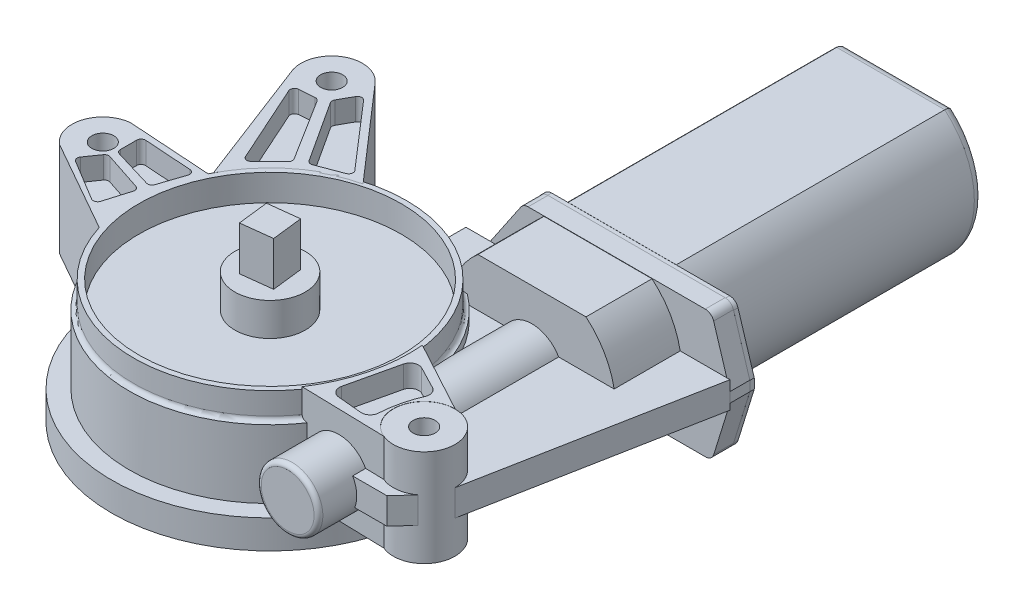
from build123d import *

# Parameters (mm, degrees)
EXTRUDE_1_DEPTH      = 63
SKETCH_4_R           = 6.75
EXTRUDE_2_DEPTH      = 5
SKETCH_5_R           = 2.5
EXTRUDE_3_DEPTH      = 2
EXTRUDE_3_TAPER      = 33
EXTRUDE_4_DEPTH      = 1
SKETCH_8_R           = 36
EXTRUDE_5_DEPTH      = 6.5
SKETCH_10_R          = 32
EXTRUDE_6_DEPTH      = 15.5
SKETCH_11_R          = 31
SKETCH_11_R_2        = 29.8
EXTRUDE_7_DEPTH      = 6
FILLET_1_R           = 1
CUT_EXTRUDE_8_DEPTH  = 1.2
SKETCH_13_R          = 8
EXTRUDE_9_DEPTH      = 7.5
EXTRUDE_10_DEPTH     = 10
SKETCH_15_R          = 7
EXTRUDE_11_DEPTH     = 75
EXTRUDE_12_DEPTH     = 19.5
EXTRUDE_13_DEPTH     = 4.5
FILLET_2_R           = 1
SKETCH_19_R          = 7
SKETCH_19_R_2        = 2.5
EXTRUDE_16_DEPTH     = 22
EXTRUDE_15_DEPTH     = 6
EXTRUDE_21_DEPTH     = 22
CUT_EXTRUDE_23_DEPTH = 5
CUT_EXTRUDE_24_DEPTH = 5
SKETCH_23_R          = 2.5
EXTRUDE_27_DEPTH     = 21.5
CUT_EXTRUDE_28_DEPTH = 5
CUT_EXTRUDE_29_DEPTH = 5
SKETCH_26_R          = 2.5
EXTRUDE_30_DEPTH     = 21.5
CUT_EXTRUDE_31_DEPTH = 5
CUT_EXTRUDE_START    = 5
CUT_EXTRUDE_32_DEPTH = 5
FILLET_3_R           = 2
FILLET_4_R           = 1
FILLET_5_R           = 0.5


with BuildPart() as part:
    # Эскиз3 → Вытянуть1 (new body)
    with BuildSketch(Plane.XY):
        with BuildLine():
            Line((-12.278029158, 14.5), (12.278029158, 14.5))
            ThreePointArc((12.278029158, 14.5), (19, 0), (12.278029158, -14.5))
            Line((12.278029158, -14.5), (-12.278029158, -14.5))
            ThreePointArc((-12.278029158, -14.5), (-19, 0), (-12.278029158, 14.5))
        make_face()
    extrude(amount=EXTRUDE_1_DEPTH)

    # Эскиз4 → Вытянуть2 (add)
    with BuildSketch(Plane(origin=(0, 0, 0), x_dir=(-1, 0, 0), z_dir=(0, 0, -1))):
        with Locations(Location((0, 0, 0), (0, 0, 180))):
            Circle(SKETCH_4_R)
    extrude(amount=EXTRUDE_2_DEPTH)

    # Эскиз5 → Вытянуть3 (add)
    with BuildSketch(Plane(origin=(0, 0, -5), x_dir=(-1, 0, 0), z_dir=(0, 0, -1))):
        Circle(SKETCH_5_R)
    extrude(amount=EXTRUDE_3_DEPTH, taper=EXTRUDE_3_TAPER)

    # Эскиз7 → Вытянуть4 (add)
    with BuildSketch(Plane.XY.offset(63)):
        with BuildLine():
            Line((-29.999706673, -12.472523442), (-29.999706673, -5.304255729))
            ThreePointArc((-29.999706673, -5.304255729), (-29.91267307, -4.720680918), (-29.659147112, -4.187896724))
            Line((-29.659147112, -4.187896724), (-17.700135478, 13.588882447))
            ThreePointArc((-17.700135478, 13.588882447), (-16.980716844, 14.237844661), (-16.040695039, 14.472523442))
            Line((-16.040695039, 14.472523442), (24.395398999, 14.472523442))
            ThreePointArc((24.395398999, 14.472523442), (25.582490106, 14.082124232), (26.306141783, 13.063338146))
            Line((26.306141783, 13.063338146), (29.999706673, 1.118049021))
            Line((29.999706673, 1.118049021), (29.999706673, -1.118049021))
            Line((29.999706673, -1.118049021), (26.306141783, -13.063338146))
            ThreePointArc((26.306141783, -13.063338146), (25.582490106, -14.082124232), (24.395398999, -14.472523442))
            Line((24.395398999, -14.472523442), (-27.999706673, -14.472523442))
            ThreePointArc((-27.999706673, -14.472523442), (-29.413920235, -13.886737004), (-29.999706673, -12.472523442))
        make_face()
    extrude(amount=EXTRUDE_4_DEPTH)



with BuildPart() as body_2:
    # Эскиз8 → Вытянуть5 (new body)
    with BuildSketch(Plane.XZ.offset(16.5)):
        with Locations(Location((-34, 109, 0), (0, 0, 270))):
            Circle(SKETCH_8_R)
    extrude(amount=-EXTRUDE_5_DEPTH)

    # Эскиз10 → Вытянуть6 (add)
    with BuildSketch(Plane(origin=(0, -10, 0), x_dir=(-1, 0, 0), z_dir=(0, -1, 0))):
        with Locations(Location((34, -109, 0), (0, 0, 270))):
            Circle(SKETCH_10_R)
    extrude(amount=-EXTRUDE_6_DEPTH)

    # Эскиз11 → Вытянуть7 (add)
    with BuildSketch(Plane(origin=(0, 5.5, 0), x_dir=(1, 0, 0), z_dir=(0, 1, 0))):
        with Locations(Location((-34, -109, 0), (0, 0, 90))):
            Circle(SKETCH_11_R)
        with Locations(Location((-34, -109, 0), (0, 0, 90))):
            Circle(SKETCH_11_R_2, mode=Mode.SUBTRACT)
    extrude(amount=EXTRUDE_7_DEPTH)

    # Скругление1
    fillet_1_edges = [body_2.edges().sort_by_distance(p)[0] for p in [
        (-34, 5.5, 140),
    ]]
    fillet(fillet_1_edges, radius=FILLET_1_R - 0.0001)  # a hair under: the kernel refuses the full size

    # Эскиз12 → Вытянуть8 (cut)
    with BuildSketch(Plane(origin=(0, -16.5, 0), x_dir=(-1, 0, 0), z_dir=(0, 1, 0))):
        with BuildLine():
            Line((65.650759184, 115.106207232), (55.113510176, 133.357257886))
            ThreePointArc((55.113510176, 133.357257886), (53.384317426, 134.357255844), (51.652273689, 133.362204097))
            Line((51.652273689, 133.362204097), (41.010180245, 115.05062148))
            ThreePointArc((41.010180245, 115.05062148), (41.007315116, 113.045675269), (42.745082033, 112.045683437))
            Line((42.745082033, 112.045683437), (63.924424485, 112.106215401))
            ThreePointArc((63.924424485, 112.106215401), (65.652186444, 113.108683404), (65.650759184, 115.106207232))
        make_face()
        with BuildLine():
            Line((55.113510176, 84.642742114), (65.650759184, 102.893792768))
            ThreePointArc((65.650759184, 102.893792768), (65.652186444, 104.891316596), (63.924424485, 105.893784599))
            Line((63.924424485, 105.893784599), (42.745082033, 105.954316563))
            ThreePointArc((42.745082033, 105.954316563), (41.007315116, 104.954324731), (41.010180245, 102.94937852))
            Line((41.010180245, 102.94937852), (51.652273689, 84.637795903))
            ThreePointArc((51.652273689, 84.637795903), (53.384317426, 83.642744156), (55.113510176, 84.642742114))
        make_face()
        with BuildLine():
            Line((23.462750992, 78.536534882), (44.537249008, 78.536534882))
            ThreePointArc((44.537249008, 78.536534882), (46.267869018, 79.534060753), (46.272150796, 81.531580502))
            Line((46.272150796, 81.531580502), (35.734901788, 99.903695083))
            ThreePointArc((35.734901788, 99.903695083), (34, 100.908649462), (32.265098212, 99.903695083))
            Line((32.265098212, 99.903695083), (21.727849204, 81.531580502))
            ThreePointArc((21.727849204, 81.531580502), (21.732130982, 79.534060753), (23.462750992, 78.536534882))
        make_face()
        with BuildLine():
            Line((2.349240816, 102.893792768), (12.886489824, 84.642742114))
            ThreePointArc((12.886489824, 84.642742114), (14.615682574, 83.642744156), (16.347726311, 84.637795903))
            Line((16.347726311, 84.637795903), (26.989819755, 102.94937852))
            ThreePointArc((26.989819755, 102.94937852), (26.992684884, 104.954324731), (25.254917967, 105.954316563))
            Line((25.254917967, 105.954316563), (4.075575515, 105.893784599))
            ThreePointArc((4.075575515, 105.893784599), (2.347813556, 104.891316596), (2.349240816, 102.893792768))
        make_face()
        with BuildLine():
            Line((12.886489824, 133.357257886), (2.349240816, 115.106207232))
            ThreePointArc((2.349240816, 115.106207232), (2.347813556, 113.108683404), (4.075575515, 112.106215401))
            Line((4.075575515, 112.106215401), (25.254917967, 112.045683437))
            ThreePointArc((25.254917967, 112.045683437), (26.992684884, 113.045675269), (26.989819755, 115.05062148))
            Line((26.989819755, 115.05062148), (16.347726311, 133.362204097))
            ThreePointArc((16.347726311, 133.362204097), (14.615682574, 134.357255844), (12.886489824, 133.357257886))
        make_face()
        with BuildLine():
            Line((46.272150796, 136.468419498), (35.734901788, 118.096304917))
            ThreePointArc((35.734901788, 118.096304917), (34, 117.091350538), (32.265098212, 118.096304917))
            Line((32.265098212, 118.096304917), (21.727849204, 136.468419498))
            ThreePointArc((21.727849204, 136.468419498), (21.732130982, 138.465939247), (23.462750992, 139.463465118))
            Line((23.462750992, 139.463465118), (44.537249008, 139.463465118))
            ThreePointArc((44.537249008, 139.463465118), (46.267869018, 138.465939247), (46.272150796, 136.468419498))
        make_face()
    extrude(amount=CUT_EXTRUDE_8_DEPTH, mode=Mode.SUBTRACT)

    # Эскиз13 → Вытянуть9 (add)
    with BuildSketch(Plane(origin=(0, 5.5, 0), x_dir=(1, 0, 0), z_dir=(0, 1, 0))):
        with Locations(Location((-34, -109, 0), (0, 0, 90))):
            Circle(SKETCH_13_R)
    extrude(amount=EXTRUDE_9_DEPTH)

    # Эскиз14 → Вытянуть10 (add)
    with BuildSketch(Plane(origin=(0, 13, 0), x_dir=(1, 0, 0), z_dir=(0, 1, 0))):
        Polygon((-37.886717904, -105.935130682), (-30.935130682, -105.113282096), (-30.113282096, -112.064869318), (-37.064869318, -112.886717904), align=None)
    extrude(amount=EXTRUDE_10_DEPTH)


with BuildPart() as part_1:
    add(part.part)

    add(body_2.part)  # Вытянуть11 merges body 2
    # Эскиз15 → Вытянуть11 (add)
    with BuildSketch(Plane.XY.offset(64)):
        Circle(SKETCH_15_R)
    extrude(amount=EXTRUDE_11_DEPTH)

    # Эскиз16 → Вытянуть12 (add)
    with BuildSketch(Plane.XY.offset(64)):
        with BuildLine():
            Line((12.278029158, 14.5), (-12.278029158, 14.5))
            ThreePointArc((-12.278029158, 14.5), (-19, 0), (-12.278029158, -14.5))
            Line((-12.278029158, -14.5), (12.278029158, -14.5))
            ThreePointArc((12.278029158, -14.5), (19, 0), (12.278029158, 14.5))
        make_face()
    extrude(amount=EXTRUDE_12_DEPTH)

    # Эскиз17 → Вытянуть13 (add)
    with BuildSketch(Plane.XY.offset(64)):
        with BuildLine():
            Line((-30.000506735, -5.270458835), (-30.000506735, -12.473349822))
            ThreePointArc((-30.000506735, -12.473349822), (-29.414720298, -13.887563384), (-28.000506735, -14.473349822))
            Line((-28.000506735, -14.473349822), (24.395143672, -14.473349822))
            ThreePointArc((24.395143672, -14.473349822), (25.582582797, -14.082693888), (26.306141783, -13.063338146))
            Line((26.306141783, -13.063338146), (29.989882528, -1.131539983))
            Line((29.989882528, -1.131539983), (29.989882528, 1.149821105))
            Line((29.989882528, 1.149821105), (26.271558155, 13.165363121))
            ThreePointArc((26.271558155, 13.165363121), (25.547857161, 14.183845377), (24.360951704, 14.574107685))
            Line((24.360951704, 14.574107685), (-15.879331843, 14.574107685))
            ThreePointArc((-15.879331843, 14.574107685), (-16.815394091, 14.341531649), (-17.533750692, 13.697895152))
            Line((-17.533750692, 13.697895152), (-29.654925585, -4.146671368))
            ThreePointArc((-29.654925585, -4.146671368), (-29.912160169, -4.682597329), (-30.000506735, -5.270458835))
        make_face()
    extrude(amount=EXTRUDE_13_DEPTH)

    # Скругление2
    fillet_2_edges = [part_1.edges().sort_by_distance(p)[0] for p in [
        (-7, 0, 139),
    ]]
    fillet(fillet_2_edges, radius=FILLET_2_R)

    # Эскиз19 → Вытянуть16 (add)
    with BuildSketch(Plane(origin=(0, -10, 0), x_dir=(-1, 0, 0), z_dir=(0, 1, 0))):
        with Locations(Location((-13, 121, 0), (0, 0, 270))):
            Circle(SKETCH_19_R)
        with Locations(Location((-13, 121, 0), (0, 0, 270))):
            Circle(SKETCH_19_R_2, mode=Mode.SUBTRACT)
    extrude(amount=EXTRUDE_16_DEPTH)

    # Эскиз18 → Вытянуть15 (add)
    with BuildSketch(Plane.XZ.offset(2.5)):
        with BuildLine():
            Line((-30.000506735, 68.5), (29.989882528, 68.5))
            Line((29.989882528, 68.5), (20, 121))
            ThreePointArc((20, 121), (6.730902758, 117.8857714), (17.229022921, 126.578114837))
            Line((17.229022921, 126.578114837), (13.852985081, 130.304291064))
            Line((13.852985081, 130.304291064), (-2.198699647, 130.304291064))
            Line((-2.198699647, 130.304291064), (-2.198699647, 112.560519039))
            ThreePointArc((-2.198699647, 112.560519039), (-8.858079937, 89.203943434), (-30.000506735, 77.250920429))
            Line((-30.000506735, 77.250920429), (-30.000506735, 68.5))
        make_face()
    extrude(amount=-EXTRUDE_15_DEPTH)


with BuildPart() as body_2_2:
    # Эскиз20 → Вытянуть21 (new body)
    with BuildSketch(Plane(origin=(0, -10, 0), x_dir=(-1, 0, 0), z_dir=(0, 1, 0))):
        with BuildLine():
            Line((-10.281803381, 127.450690439), (8.747251335, 126.980508471))
            ThreePointArc((8.747251335, 126.980508471), (4.140840515, 116.536285267), (3.239124064, 105.157017873))
            Line((3.239124064, 105.157017873), (-13.033631741, 113.982002633))
            ThreePointArc((-13.033631741, 113.982002633), (-6.0975253, 119.580326831), (-10.281803381, 127.450690439))
        make_face()
    extrude(amount=EXTRUDE_21_DEPTH)

    # Эскиз21 → Вытянуть23 (cut)
    with BuildSketch(Plane(origin=(0, 12, 0), x_dir=(1, 0, 0), z_dir=(0, 1, 0))):
        with BuildLine():
            Line((-2.553971332, -124.865540556), (2.9538554, -125.372537159))
            ThreePointArc((2.9538554, -125.372537159), (4.441633286, -124.897005627), (5.133821257, -123.496830964))
            ThreePointArc((5.133821257, -123.496830964), (5.773049795, -119.114606009), (7.160260604, -114.908877195))
            ThreePointArc((7.160260604, -114.908877195), (7.20556388, -113.446296639), (6.242830265, -112.344326469))
            Line((6.242830265, -112.344326469), (1.173897826, -109.716852316))
            ThreePointArc((1.173897826, -109.716852316), (-0.585667476, -109.677051952), (-1.695369159, -111.043147225))
            Line((-1.695369159, -111.043147225), (-4.319516369, -122.424622913))
            ThreePointArc((-4.319516369, -122.424622913), (-3.991165766, -124.046101763), (-2.553971332, -124.865540556))
        make_face()
    extrude(amount=-CUT_EXTRUDE_23_DEPTH, mode=Mode.SUBTRACT)


with BuildPart() as cut_extrude_24_tool:
    # Эскиз22 → Вытянуть24 (new body)
    with BuildSketch(Plane.XZ.offset(10)):
        with BuildLine():
            Line((1.293580994, 110.157311605), (6.316997165, 112.472153033))
            ThreePointArc((6.316997165, 112.472153033), (7.367684843, 113.627864363), (7.267049879, 115.186545177))
            ThreePointArc((7.267049879, 115.186545177), (5.629525554, 119.301277582), (4.728020948, 123.637150981))
            ThreePointArc((4.728020948, 123.637150981), (4.035964458, 124.926434535), (2.651227605, 125.399401889))
            Line((2.651227605, 125.399401889), (-3.052333733, 125.140395034))
            ThreePointArc((-3.052333733, 125.140395034), (-4.596062166, 124.295080509), (-4.874044378, 122.557156457))
            Line((-4.874044378, 122.557156457), (-1.455884681, 111.388435774))
            ThreePointArc((-1.455884681, 111.388435774), (-0.360785293, 110.1483692), (1.293580994, 110.157311605))
        make_face()
    extrude(amount=-CUT_EXTRUDE_24_DEPTH)


with BuildPart() as part_2:
    add(part_1.part)

    # Вытянуть24: cut by cut_extrude_24_tool
    add(cut_extrude_24_tool.part, mode=Mode.SUBTRACT)

    # Эскиз26 → Вытянуть30 (add)
    with BuildSketch(Plane(origin=(0, -10, 0), x_dir=(-1, 0, 0), z_dir=(0, 1, 0))):
        with BuildLine():
            Line((84.547217028, 106.321918573), (63.600457047, 118.209394258))
            ThreePointArc((63.600457047, 118.209394258), (64.904726914, 106.571450154), (61.798629742, 95.280080741))
            Line((61.798629742, 95.280080741), (80.667283591, 94.031877397))
            ThreePointArc((80.667283591, 94.031877397), (86.675255216, 98.892639614), (84.547217028, 106.321918573))
        make_face()
        with Locations(Location((80, 101, 0), (0, 0, 270))):
            Circle(SKETCH_26_R, mode=Mode.SUBTRACT)
    extrude(amount=EXTRUDE_30_DEPTH)

    # Эскиз27 → Вытянуть31 (cut)
    with BuildSketch(Plane(origin=(0, -10, 0), x_dir=(-1, 0, 0), z_dir=(0, -1, 0))):
        with BuildLine():
            Line((63.817747863, -97.804526135), (65.705799185, -103.468680102))
            ThreePointArc((65.705799185, -103.468680102), (66.194578879, -104.040421184), (66.943569023, -104.109755304))
            Line((66.943569023, -104.109755304), (75.82388988, -101.428074253))
            ThreePointArc((75.82388988, -101.428074253), (76.337637862, -101.066973206), (76.53480334, -100.470771285))
            Line((76.53480334, -100.470771285), (76.53480334, -96.761860564))
            ThreePointArc((76.53480334, -96.761860564), (76.217698889, -96.031344535), (75.467496003, -95.764128274))
            Line((75.467496003, -95.764128274), (64.699123824, -96.490566079))
            ThreePointArc((64.699123824, -96.490566079), (63.93596021, -96.931236434), (63.817747863, -97.804526135))
        make_face()
        with BuildLine():
            Line((67.524701183, -105.950544147), (76.335080816, -103.047317924))
            ThreePointArc((76.335080816, -103.047317924), (76.963038227, -103.047985604), (77.466786043, -103.422911054))
            Line((77.466786043, -103.422911054), (79.596331828, -106.459529813))
            ThreePointArc((79.596331828, -106.459529813), (79.756147486, -107.239701497), (79.295356968, -107.889225168))
            Line((79.295356968, -107.889225168), (70.061804018, -113.477342131))
            ThreePointArc((70.061804018, -113.477342131), (69.183954728, -113.554735203), (68.585753153, -112.907615478))
            Line((68.585753153, -112.907615478), (66.879380685, -107.186105979))
            ThreePointArc((66.879380685, -107.186105979), (66.951285564, -106.437358262), (67.524701183, -105.950544147))
        make_face()
    extrude(amount=-CUT_EXTRUDE_31_DEPTH, mode=Mode.SUBTRACT)

    # Эскиз28 → Вытянуть32 (cut)
    with BuildSketch(Plane.XZ.offset(-11.5).offset(CUT_EXTRUDE_START)):
        with BuildLine():
            Line((-66.879380685, 107.186105979), (-68.585753153, 112.907615478))
            ThreePointArc((-68.585753153, 112.907615478), (-69.183954728, 113.554735203), (-70.061804018, 113.477342131))
            Line((-70.061804018, 113.477342131), (-79.295356968, 107.889225168))
            ThreePointArc((-79.295356968, 107.889225168), (-79.756147486, 107.239701497), (-79.596331828, 106.459529813))
            Line((-79.596331828, 106.459529813), (-77.466786043, 103.422911054))
            ThreePointArc((-77.466786043, 103.422911054), (-76.963038227, 103.047985604), (-76.335080816, 103.047317924))
            Line((-76.335080816, 103.047317924), (-67.524701183, 105.950544147))
            ThreePointArc((-67.524701183, 105.950544147), (-66.951285564, 106.437358262), (-66.879380685, 107.186105979))
        make_face()
        with BuildLine():
            Line((-75.82388988, 101.428074253), (-66.943569023, 104.109755304))
            ThreePointArc((-66.943569023, 104.109755304), (-66.194578879, 104.040421184), (-65.705799185, 103.468680102))
            Line((-65.705799185, 103.468680102), (-63.817747863, 97.804526135))
            ThreePointArc((-63.817747863, 97.804526135), (-63.93596021, 96.931236434), (-64.699123824, 96.490566079))
            Line((-64.699123824, 96.490566079), (-75.467496003, 95.764128274))
            ThreePointArc((-75.467496003, 95.764128274), (-76.217698889, 96.031344535), (-76.53480334, 96.761860564))
            Line((-76.53480334, 96.761860564), (-76.53480334, 100.470771285))
            ThreePointArc((-76.53480334, 100.470771285), (-76.337637862, 101.066973206), (-75.82388988, 101.428074253))
        make_face()
    extrude(amount=-CUT_EXTRUDE_32_DEPTH, mode=Mode.SUBTRACT)

    # Скругление3
    fillet_3_edges = [part_2.edges().sort_by_distance(p)[0] for p in [
        (0, 14.5, 0),
        (19, 0, 0),
        (0, -14.5, 0),
        (-19, 0, 0),
    ]]
    fillet(fillet_3_edges, radius=FILLET_3_R)

    # Скругление4
    fillet_4_edges = [part_2.edges().sort_by_distance(p)[0] for p in [
        (-6.75, 0, -5),
    ]]
    fillet(fillet_4_edges, radius=FILLET_4_R)

    # Скругление5
    fillet_5_edges = [part_2.edges().sort_by_distance(p)[0] for p in [
        (1.201184814, 0, -7),
    ]]
    fillet(fillet_5_edges, radius=FILLET_5_R)


with BuildPart() as body_2_2_1:
    add(body_2_2.part)

    # Вытянуть24: cut by cut_extrude_24_tool
    add(cut_extrude_24_tool.part, mode=Mode.SUBTRACT)


with BuildPart() as body_3:
    # Эскиз23 → Вытянуть27 (new body)
    with BuildSketch(Plane(origin=(0, -10, 0), x_dir=(-1, 0, 0), z_dir=(0, 1, 0))):
        with BuildLine():
            Line((72.370655171, 65.900819315), (61.384829475, 94.471713294))
            ThreePointArc((61.384829475, 94.471713294), (53.382792718, 85.013413313), (42.198871445, 79.683128542))
            Line((42.198871445, 79.683128542), (60.687272244, 58.442048291))
            ThreePointArc((60.687272244, 58.442048291), (69.766711948, 57.099840587), (72.370655171, 65.900819315))
        make_face()
        with Locations(Location((66, 63, 0), (0, 0, 270))):
            Circle(SKETCH_23_R, mode=Mode.SUBTRACT)
    extrude(amount=EXTRUDE_27_DEPTH)

    # Эскиз24 → Вытянуть28 (cut)
    with BuildSketch(Plane(origin=(0, -10, 0), x_dir=(1, 0, 0), z_dir=(0, 1, 0))):
        with BuildLine():
            Line((-60.936916448, -87.639928714), (-68.983234589, -69.766608345))
            ThreePointArc((-68.983234589, -69.766608345), (-68.930043373, -68.843568458), (-68.142836339, -68.358659166))
            Line((-68.142836339, -68.358659166), (-64.657065292, -68.10892828))
            ThreePointArc((-64.657065292, -68.10892828), (-64.133038373, -68.214641428), (-63.738345855, -68.575192808))
            Line((-63.738345855, -68.575192808), (-54.964626671, -82.569757598))
            ThreePointArc((-54.964626671, -82.569757598), (-54.818814286, -83.218443684), (-55.111994251, -83.815185167))
            Line((-55.111994251, -83.815185167), (-59.325166342, -87.943671634))
            ThreePointArc((-59.325166342, -87.943671634), (-60.210253804, -88.212124736), (-60.936916448, -87.639928714))
        make_face()
        with BuildLine():
            Line((-51.70101888, -81.637589481), (-46.182731429, -79.553429414))
            ThreePointArc((-46.182731429, -79.553429414), (-45.56668766, -78.86354757), (-45.779885235, -77.963551082))
            Line((-45.779885235, -77.963551082), (-58.606317387, -63.141896151))
            ThreePointArc((-58.606317387, -63.141896151), (-59.466004138, -62.801645322), (-60.237200338, -63.311633908))
            Line((-60.237200338, -63.311633908), (-61.930870787, -66.368502522))
            ThreePointArc((-61.930870787, -66.368502522), (-62.055536625, -66.888346643), (-61.894600134, -67.398129859))
            Line((-61.894600134, -67.398129859), (-52.892784984, -81.247076244))
            ThreePointArc((-52.892784984, -81.247076244), (-52.365726618, -81.652371654), (-51.70101888, -81.637589481))
        make_face()
    extrude(amount=CUT_EXTRUDE_28_DEPTH, mode=Mode.SUBTRACT)

    # Эскиз25 → Вытянуть29 (cut)
    with BuildSketch(Plane.XZ.offset(-11.5)):
        with BuildLine():
            Line((-68.983234589, 69.766608345), (-60.936916448, 87.639928714))
            ThreePointArc((-60.936916448, 87.639928714), (-60.210253804, 88.212124736), (-59.325166342, 87.943671634))
            Line((-59.325166342, 87.943671634), (-55.111994251, 83.815185167))
            ThreePointArc((-55.111994251, 83.815185167), (-54.818814286, 83.218443684), (-54.964626671, 82.569757598))
            Line((-54.964626671, 82.569757598), (-63.738345855, 68.575192808))
            ThreePointArc((-63.738345855, 68.575192808), (-64.133038373, 68.214641428), (-64.657065292, 68.10892828))
            Line((-64.657065292, 68.10892828), (-68.142836339, 68.358659166))
            ThreePointArc((-68.142836339, 68.358659166), (-68.930043373, 68.843568458), (-68.983234589, 69.766608345))
        make_face()
        with BuildLine():
            Line((-58.606317387, 63.141896151), (-45.779885235, 77.963551082))
            ThreePointArc((-45.779885235, 77.963551082), (-45.56668766, 78.86354757), (-46.182731429, 79.553429414))
            Line((-46.182731429, 79.553429414), (-51.70101888, 81.637589481))
            ThreePointArc((-51.70101888, 81.637589481), (-52.365726618, 81.652371654), (-52.892784984, 81.247076244))
            Line((-52.892784984, 81.247076244), (-61.894600134, 67.398129859))
            ThreePointArc((-61.894600134, 67.398129859), (-62.055536625, 66.888346643), (-61.930870787, 66.368502522))
            Line((-61.930870787, 66.368502522), (-60.237200338, 63.311633908))
            ThreePointArc((-60.237200338, 63.311633908), (-59.466004138, 62.801645322), (-58.606317387, 63.141896151))
        make_face()
    extrude(amount=CUT_EXTRUDE_29_DEPTH, mode=Mode.SUBTRACT)


solid = Compound([part_2.part, body_2_2_1.part, body_3.part])
